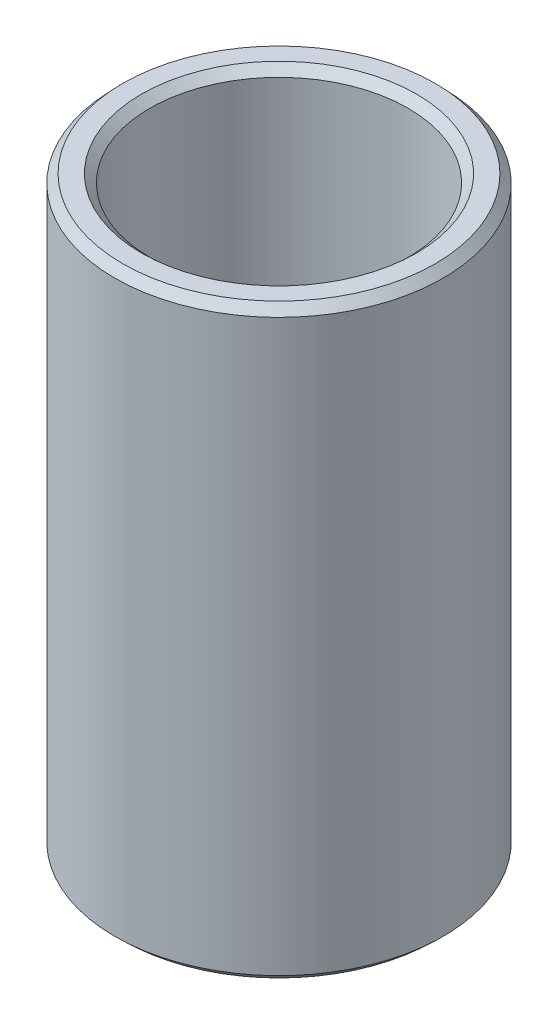
from build123d import *
from OCP.BRepFilletAPI import BRepFilletAPI_MakeChamfer

# Parameters (mm, degrees)
SKETCH1_R           = 57.5
BOSS_EXTRUDE1_DEPTH = 205.373040129
SKETCH2_R           = 45.223741895
CUT_EXTRUDE1_DEPTH  = 221.88591085
CHAMFER1_SIZE       = 2.959692765
CHAMFER1_SIZE2      = 2.792099346


with BuildPart() as part:
    # Sketch1 → Boss-Extrude1 (new body)
    with BuildSketch(Plane(origin=(0, 0, 0), x_dir=(1, 0, 0), z_dir=(0, 1, 0))):
        Circle(SKETCH1_R)
    extrude(amount=BOSS_EXTRUDE1_DEPTH)

    # Sketch2 → Cut-Extrude1 (cut, through all)
    with BuildSketch(Plane(origin=(0, 0, 0), x_dir=(1, 0, 0), z_dir=(0, 1, 0))):
        Circle(SKETCH2_R)
    extrude(amount=CUT_EXTRUDE1_DEPTH, mode=Mode.SUBTRACT)

    # Chamfer1: one chamfer whose edges measure the first distance from different faces: ONE call of the kernel's chamfer builder (chamfer() names one face for all edges)
    chamfer1_edges_1 = [part.edges().sort_by_distance(p)[0] for p in [
        (-45.223741895, 205.373040129, 0),
    ]]
    chamfer1_side_1 = [part.faces().sort_by_distance(p)[0] for p in [
        (-55.873654403, 205.373040129, 0),
    ]]
    chamfer1_edges_2 = [part.edges().sort_by_distance(p)[0] for p in [
        (-45.223741895, 0, 0),
    ]]
    chamfer1_side_2 = [part.faces().sort_by_distance(p)[0] for p in [
        (-45.223741895, 102.686520065, 0),
    ]]
    chamfer1_edges_3 = [part.edges().sort_by_distance(p)[0] for p in [
        (-57.5, 0, 0),
    ]]
    chamfer1_side_3 = [part.faces().sort_by_distance(p)[0] for p in [
        (-55.873654403, 0, 0),
    ]]
    chamfer1_edges_4 = [part.edges().sort_by_distance(p)[0] for p in [
        (-57.5, 205.373040129, 0),
    ]]
    chamfer1_side_4 = [part.faces().sort_by_distance(p)[0] for p in [
        (-57.5, 102.686520065, 0),
    ]]
    chamfer1 = BRepFilletAPI_MakeChamfer(part.part.solid().wrapped)
    for e in chamfer1_edges_1:
        chamfer1.Add(CHAMFER1_SIZE, CHAMFER1_SIZE2, e.wrapped, chamfer1_side_1[0].wrapped)  # the first distance lies on this face
    for e in chamfer1_edges_2:
        chamfer1.Add(CHAMFER1_SIZE, CHAMFER1_SIZE2, e.wrapped, chamfer1_side_2[0].wrapped)  # the first distance lies on this face
    for e in chamfer1_edges_3:
        chamfer1.Add(CHAMFER1_SIZE, CHAMFER1_SIZE2, e.wrapped, chamfer1_side_3[0].wrapped)  # the first distance lies on this face
    for e in chamfer1_edges_4:
        chamfer1.Add(CHAMFER1_SIZE, CHAMFER1_SIZE2, e.wrapped, chamfer1_side_4[0].wrapped)  # the first distance lies on this face
    add(Compound.cast(chamfer1.Shape()), mode=Mode.REPLACE)


solid = part.part
